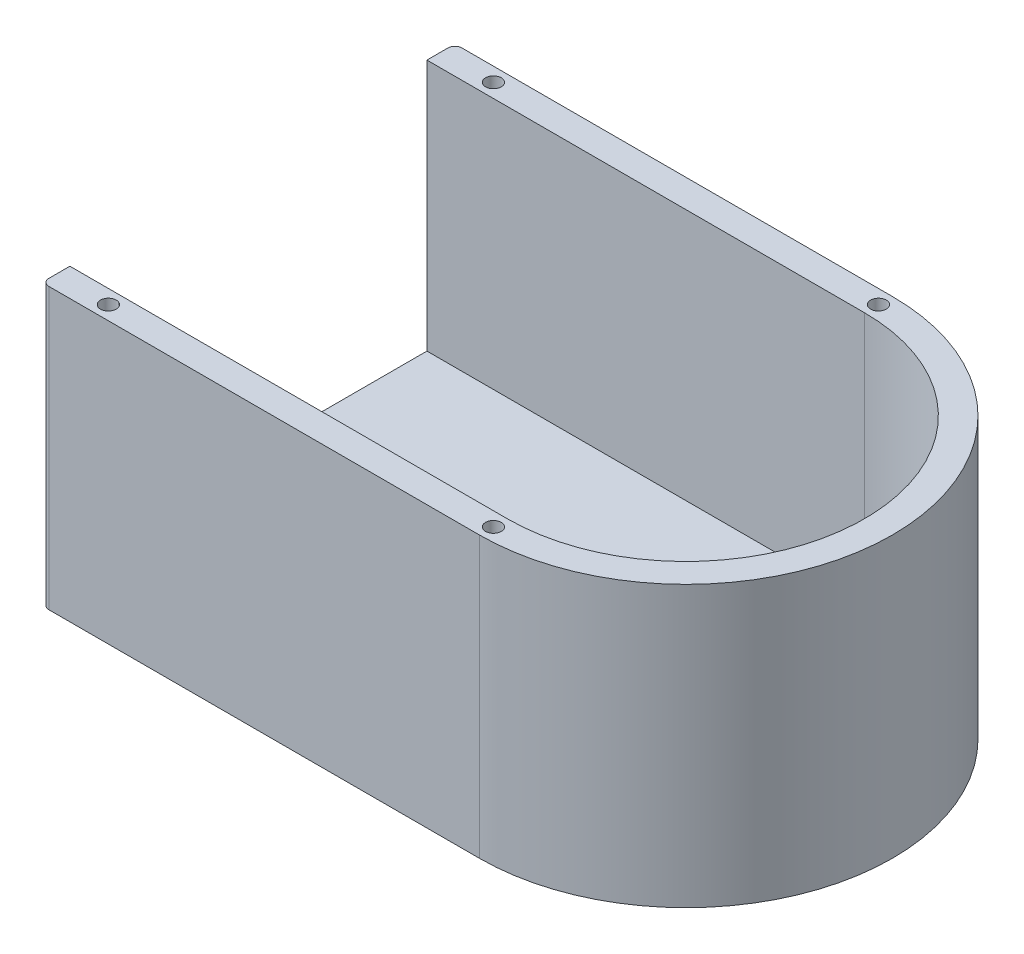
from build123d import *

# Parameters (mm, degrees)
BOTTOMEXTRUDE_DEPTH = 80
SHELL1_T            = -8
SKETCH3_W           = 102
SKETCH3_H           = 72
CUT_EXTRUDE1_DEPTH  = 160.70597985
SKETCH4_R           = 2.25
CUT_EXTRUDE2_DEPTH  = 6
SKETCH5_R           = 2.25
CUT_EXTRUDE3_DEPTH  = 6
FILLET2_R           = 2
FILLET3_R           = 2


with BuildPart() as part:
    # Sketch2 → BottomExtrude (new body)
    with BuildSketch(Plane(origin=(0, 0, 0), x_dir=(1, 0, 0), z_dir=(0, 1, 0))):
        with BuildLine():
            Line((-125, 59), (0, 59))
            ThreePointArc((0, 59), (59, 0), (0, -59))
            Line((0, -59), (-125, -59))
            Line((-125, -59), (-125, 59))
        make_face()
    extrude(amount=BOTTOMEXTRUDE_DEPTH)

    # Shell1
    shell1_openings = [part.faces().sort_by_distance(p)[0] for p in [
        (-38.824706597, 80, 0),
    ]]
    offset(amount=SHELL1_T, openings=shell1_openings, kind=Kind.INTERSECTION)

    # Sketch3 → Cut-Extrude1 (cut, through all)
    with BuildSketch(Plane(origin=(0, 0, 0), x_dir=(0, 0, -1), z_dir=(1, 0, 0))):
        with Locations((0, 44)):
            Rectangle(SKETCH3_W, SKETCH3_H)
    extrude(amount=-CUT_EXTRUDE1_DEPTH, mode=Mode.SUBTRACT)

    # Sketch4 → Cut-Extrude2 (cut)
    with BuildSketch(Plane.ZY.offset(125)):
        with Locations((-55, 70)):
            Circle(SKETCH4_R)
        with Locations((55, 70)):
            Circle(SKETCH4_R)
        with Locations((55, 5)):
            Circle(SKETCH4_R)
        with Locations((-55, 5)):
            Circle(SKETCH4_R)
    extrude(amount=-CUT_EXTRUDE2_DEPTH, mode=Mode.SUBTRACT)

    # Sketch5 → Cut-Extrude3 (cut)
    with BuildSketch(Plane(origin=(0, 80, 0), x_dir=(1, 0, 0), z_dir=(0, 1, 0))):
        with Locations(Location((0, 55, 0), (0, 0, 270))):
            Circle(SKETCH5_R)
        with Locations(Location((-110, 55, 0), (0, 0, 270))):
            Circle(SKETCH5_R)
        with Locations(Location((-110, -55, 0), (0, 0, 270))):
            Circle(SKETCH5_R)
        with Locations(Location((0, -55, 0), (0, 0, 270))):
            Circle(SKETCH5_R)
    extrude(amount=-CUT_EXTRUDE3_DEPTH, mode=Mode.SUBTRACT)

    # Fillet2
    # the kernel refuses this fillet: 2 mm, written as the material it takes off along each edge
    with BuildSketch(Plane(origin=(-125, -5, -59), x_dir=(0, 0, 1), z_dir=(0, 1, 0))) as fillet2_piece_1:
        with BuildLine():
            CenterArc((FILLET2_R, FILLET2_R), FILLET2_R, 180, 90)
            Line((0, FILLET2_R), (0, 0))
            Line((0, 0), (FILLET2_R, 0))
        make_face()
    extrude(amount=90, mode=Mode.SUBTRACT)

    # Fillet3
    # the kernel refuses this fillet: 2 mm, written as the material it takes off along each edge
    with BuildSketch(Plane(origin=(-125, -5, 59), x_dir=(1, 0, 0), z_dir=(0, 1, 0))) as fillet3_piece_1:
        with BuildLine():
            CenterArc((FILLET3_R, FILLET3_R), FILLET3_R, 180, 90)
            Line((0, FILLET3_R), (0, 0))
            Line((0, 0), (FILLET3_R, 0))
        make_face()
    extrude(amount=90, mode=Mode.SUBTRACT)


solid = part.part
